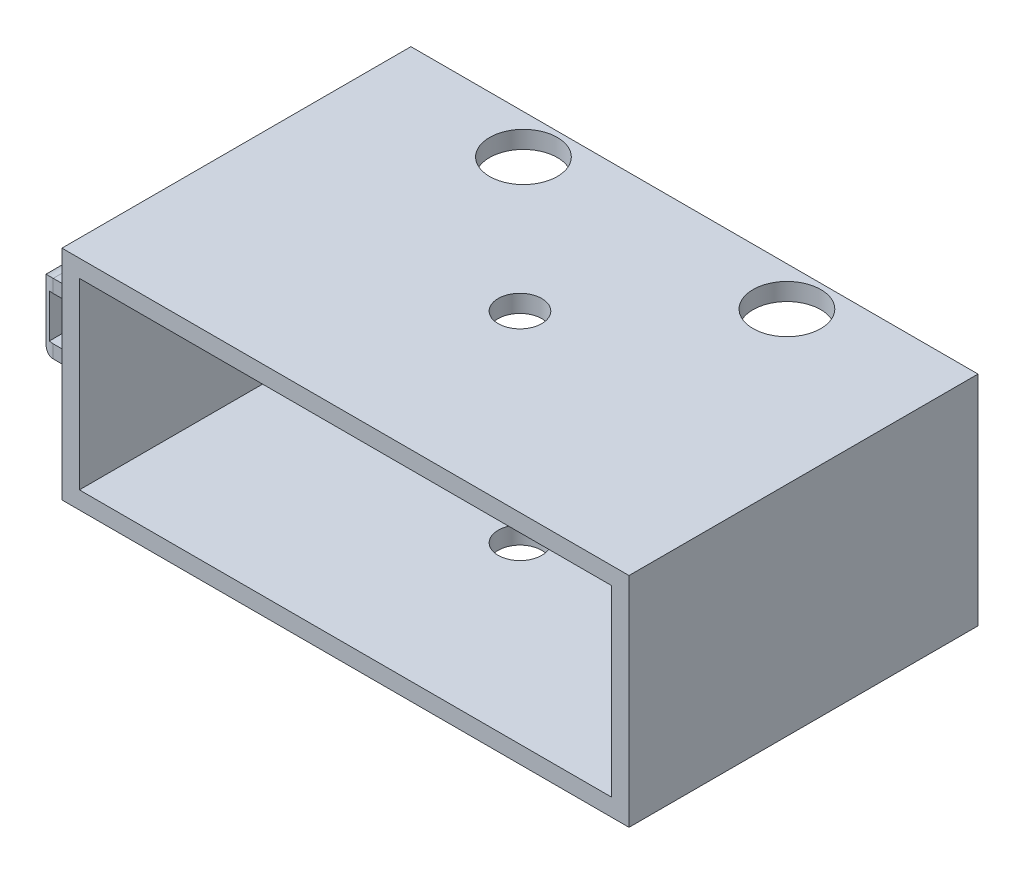
from build123d import *

# Parameters (mm, degrees)
SKETCH1_W           = 65
SKETCH1_H           = 40
BOSS_EXTRUDE1_DEPTH = 25
SKETCH8_W           = 61
SKETCH8_H           = 21
CUT_EXTRUDE1_DEPTH  = 40
SKETCH9_R           = 2.5
CUT_EXTRUDE2_DEPTH  = 30
SKETCH10_R          = 3.881431072
CUT_EXTRUDE3_DEPTH  = 26
SKETCH11_W          = 8
SKETCH11_H          = 8
BOSS_EXTRUDE2_DEPTH = 8
SKETCH12_W          = 5
SKETCH12_H          = 5
CUT_EXTRUDE4_DEPTH  = 52
FILLET1_R           = 2
FILLET2_START       = 6.4999999
FILLET2_DEPTH       = 12.0000001
FILLET2_START_2     = 7.897261538
FILLET2_2_DEPTH     = 2.102738462
FILLET2_START_3     = 15
FILLET2_3_DEPTH     = 2.089446154
FILLET2_START_4     = -1
FILLET2_4_DEPTH     = 42
FILLET3_START       = 5
FILLET3_DEPTH       = 30
FILLET3_START_2     = 8
FILLET3_2_DEPTH     = 9


with BuildPart() as part:
    # Sketch1 → Boss-Extrude1 (new body)
    with BuildSketch(Plane(origin=(0, 0, 0), x_dir=(1, 0, 0), z_dir=(0, 1, 0))):
        with Locations((32.5, -20)):
            Rectangle(SKETCH1_W, SKETCH1_H)
    extrude(amount=BOSS_EXTRUDE1_DEPTH)

    # Sketch8 → Cut-Extrude1 (cut)
    with BuildSketch(Plane(origin=(0, 0, 0), x_dir=(-1, 0, 0), z_dir=(0, 0, -1))):
        with Locations((-32.5, 12.5)):
            Rectangle(SKETCH8_W, SKETCH8_H)
    extrude(amount=-CUT_EXTRUDE1_DEPTH, mode=Mode.SUBTRACT)

    # Sketch9 → Cut-Extrude2 (cut)
    with BuildSketch(Plane(origin=(0, 25, 0), x_dir=(1, 0, 0), z_dir=(0, 1, 0))):
        with Locations(Location((32.5, -20, 0), (0, 0, 270))):
            Circle(SKETCH9_R)
    extrude(amount=-CUT_EXTRUDE2_DEPTH, mode=Mode.SUBTRACT)

    # Sketch10 → Cut-Extrude3 (cut)
    with BuildSketch(Plane.XZ):
        with Locations(Location((17.4, 4.5, 0), (0, 0, 90))):
            Circle(SKETCH10_R)
        with Locations(Location((47.6, 4.5, 0), (0, 0, 90))):
            Circle(SKETCH10_R)
    extrude(amount=-CUT_EXTRUDE3_DEPTH, mode=Mode.SUBTRACT)

    # Sketch11 → Boss-Extrude2 (add)
    with BuildSketch(Plane.ZY):
        with Locations((9, 12.5)):
            Rectangle(SKETCH11_W, SKETCH11_H)
        with Locations((31, 12.5)):
            Rectangle(SKETCH11_W, SKETCH11_H)
    extrude(amount=BOSS_EXTRUDE2_DEPTH)

    # Sketch12 → Cut-Extrude4 (cut)
    with BuildSketch(Plane(origin=(0, 0, 5), x_dir=(-1, 0, 0), z_dir=(0, 0, -1))):
        with Locations((4, 12.5)):
            Rectangle(SKETCH12_W, SKETCH12_H)
    extrude(amount=-CUT_EXTRUDE4_DEPTH, mode=Mode.SUBTRACT)

    # Fillet1
    fillet1_edges = [part.edges().sort_by_distance(p)[0] for p in [
        (0, 8.5, 9),
        (0, 16.5, 9),
        (0, 8.5, 31),
        (0, 16.5, 31),
    ]]
    fillet(fillet1_edges, radius=FILLET1_R)

    # Fillet2: read off the stored shape, not the designer's step
    # Fillet2 outline → Fillet2 (add)
    with BuildSketch(Plane(origin=(0, 0, 0), x_dir=(1, 0, 0), z_dir=(0, 1, 0)).offset(FILLET2_START)):
        with BuildLine():
            ThreePointArc((-1.5, -14.429285786), (-0.390227771, -16.063508327), (0, -18))
            Line((0, -18), (0, -13))
            Line((0, -13), (-1.5, -13))
            Line((-1.5, -13), (-1.5, -14.429285786))
        make_face()
        with BuildLine():
            Line((-1.5, -35), (-1.5, -36.429285786))
            ThreePointArc((-1.5, -36.429285786), (-0.390227771, -38.063508327), (0, -40))
            Line((0, -40), (0, -35))
            Line((0, -35), (-1.5, -35))
        make_face()
        with BuildLine():
            Line((-1.5, -25.570714214), (-1.5, -27))
            Line((-1.5, -27), (0, -27))
            Line((0, -27), (0, -22))
            ThreePointArc((0, -22), (-0.390227771, -23.936491673), (-1.5, -25.570714214))
        make_face()
        with BuildLine():
            Line((-1.5, -5), (0, -5))
            Line((0, -5), (0, 0))
            ThreePointArc((0, 0), (-0.390227771, -1.936491673), (-1.5, -3.570714214))
            Line((-1.5, -3.570714214), (-1.5, -5))
        make_face()
    extrude(amount=FILLET2_DEPTH)

    # Fillet2 2 outline → Fillet2 2 (add)
    with BuildSketch(Plane(origin=(0, 0, 0), x_dir=(1, 0, 0), z_dir=(0, 1, 0)).offset(FILLET2_START_2)):
        with BuildLine():
            ThreePointArc((-5, -35), (-3.109705191, -35.371092404), (-1.5, -36.429285786))
            Line((-1.5, -36.429285786), (-1.5, -35))
            Line((-1.5, -35), (-5, -35))
        make_face()
        with BuildLine():
            Line((-5, -27), (-1.5, -27))
            Line((-1.5, -27), (-1.5, -25.570714214))
            ThreePointArc((-1.5, -25.570714214), (-3.109705191, -26.628907596), (-5, -27))
        make_face()
        with BuildLine():
            ThreePointArc((-5, -13), (-3.109705191, -13.371092404), (-1.5, -14.429285786))
            Line((-1.5, -14.429285786), (-1.5, -13))
            Line((-1.5, -13), (-5, -13))
        make_face()
        with BuildLine():
            Line((-5, -5), (-1.5, -5))
            Line((-1.5, -5), (-1.5, -3.570714214))
            ThreePointArc((-1.5, -3.570714214), (-3.109705191, -4.628907596), (-5, -5))
        make_face()
    extrude(amount=FILLET2_2_DEPTH)

    # Fillet2 3 outline → Fillet2 3 (add)
    with BuildSketch(Plane(origin=(0, 0, 0), x_dir=(1, 0, 0), z_dir=(0, 1, 0)).offset(FILLET2_START_3)):
        with BuildLine():
            ThreePointArc((-5, -35), (-3.109705191, -35.371092404), (-1.5, -36.429285786))
            Line((-1.5, -36.429285786), (-1.5, -35))
            Line((-1.5, -35), (-5, -35))
        make_face()
        with BuildLine():
            Line((-5, -27), (-1.5, -27))
            Line((-1.5, -27), (-1.5, -25.570714214))
            ThreePointArc((-1.5, -25.570714214), (-3.109705191, -26.628907596), (-5, -27))
        make_face()
        with BuildLine():
            ThreePointArc((-5, -13), (-3.109705191, -13.371092404), (-1.5, -14.429285786))
            Line((-1.5, -14.429285786), (-1.5, -13))
            Line((-1.5, -13), (-5, -13))
        make_face()
        with BuildLine():
            Line((-5, -5), (-1.5, -5))
            Line((-1.5, -5), (-1.5, -3.570714214))
            ThreePointArc((-1.5, -3.570714214), (-3.109705191, -4.628907596), (-5, -5))
        make_face()
    extrude(amount=FILLET2_3_DEPTH)

    # Fillet2 4 outline → Fillet2 4 (cut)
    with BuildSketch(Plane.XY.offset(FILLET2_START_4)):
        with BuildLine():
            Line((-5, 16.5), (-2, 16.5))
            ThreePointArc((-2, 16.5), (-0.585786438, 17.085786438), (0, 18.5))
            Line((0, 18.5), (-1.5, 18.5))
            Line((-1.5, 18.5), (-1.5, 17.089446154))
            Line((-1.5, 17.089446154), (-5, 17.089446154))
            Line((-5, 17.089446154), (-5, 16.5))
        make_face()
        with BuildLine():
            Line((-5, 7.897261538), (-1.5, 7.897261538))
            Line((-1.5, 7.897261538), (-1.5, 6.4999999))
            Line((-1.5, 6.4999999), (0, 6.49999995))
            ThreePointArc((0, 6.49999995), (-0.58578642, 7.914213545), (-2, 8.5))
            Line((-2, 8.5), (-5, 8.5))
            Line((-5, 8.5), (-5, 7.897261538))
        make_face()
    extrude(amount=FILLET2_4_DEPTH, mode=Mode.SUBTRACT)

    # Fillet3: read off the stored shape, not the designer's step
    # Fillet3 outline → Fillet3 (cut)
    with BuildSketch(Plane.XY.offset(FILLET3_START)):
        with BuildLine():
            Line((-8, 8.5), (-6, 8.5))
            ThreePointArc((-6, 8.5), (-7.414213562, 9.085786438), (-8, 10.5))
            Line((-8, 10.5), (-8, 8.5))
        make_face()
        with BuildLine():
            Line((-8, 16.5), (-8, 14.5))
            ThreePointArc((-8, 14.5), (-7.414213562, 15.914213562), (-6, 16.5))
            Line((-6, 16.5), (-8, 16.5))
        make_face()
    extrude(amount=FILLET3_DEPTH, mode=Mode.SUBTRACT)

    # Fillet3 2 outline → Fillet3 2 (cut)
    with BuildSketch(Plane(origin=(0, 0, 0), x_dir=(1, 0, 0), z_dir=(0, 1, 0)).offset(FILLET3_START_2)):
        with BuildLine():
            Line((-8, -35), (-6, -35))
            ThreePointArc((-6, -35), (-7.414213562, -34.414213562), (-8, -33))
            Line((-8, -33), (-8, -35))
        make_face()
        with BuildLine():
            Line((-8, -27), (-8, -29))
            ThreePointArc((-8, -29), (-7.414213562, -27.585786438), (-6, -27))
            Line((-6, -27), (-8, -27))
        make_face()
        with BuildLine():
            Line((-8, -13), (-6, -13))
            ThreePointArc((-6, -13), (-7.414213562, -12.414213562), (-8, -11))
            Line((-8, -11), (-8, -13))
        make_face()
        with BuildLine():
            Line((-8, -5), (-8, -7))
            ThreePointArc((-8, -7), (-7.414213562, -5.585786438), (-6, -5))
            Line((-6, -5), (-8, -5))
        make_face()
    extrude(amount=FILLET3_2_DEPTH, mode=Mode.SUBTRACT)


solid = part.part
